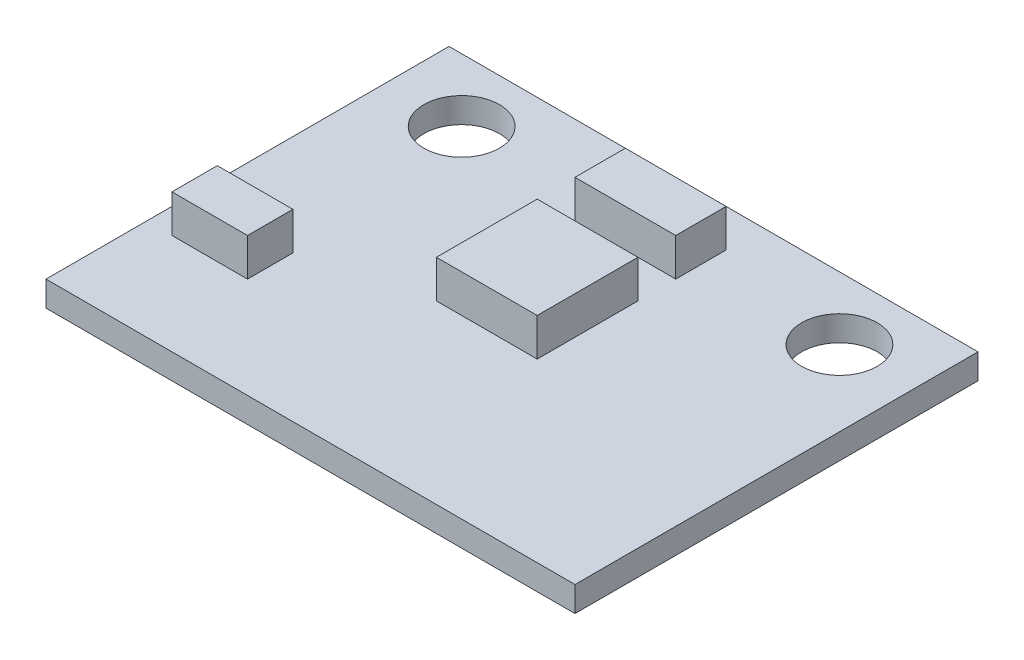
from build123d import *

# Parameters (mm, degrees)
SKETCH1_W        = 21
SKETCH1_H        = 16
SKETCH1_R        = 1.5
PCB_DEPTH        = 1
SKETCH2_W        = 4
SKETCH2_H        = 4
SKETCH2_W_2      = 3
SKETCH2_H_2      = 1.8
COMPONENTS_DEPTH = 1.5
SKETCH3_W        = 4
SKETCH3_H        = 2
CAPACITOR_DEPTH  = 1.5


with BuildPart() as part:
    # Sketch1 → PCB (new body)
    with BuildSketch(Plane(origin=(0, 0, 0), x_dir=(1, 0, 0), z_dir=(0, 1, 0))):
        Rectangle(SKETCH1_W, SKETCH1_H)
        with Locations((-7.5, 5.5)):
            Circle(SKETCH1_R, mode=Mode.SUBTRACT)
        with Locations((7.5, 5.5)):
            Circle(SKETCH1_R, mode=Mode.SUBTRACT)
    extrude(amount=PCB_DEPTH)

    # Sketch2 → Components (add)
    with BuildSketch(Plane(origin=(0, 1, 0), x_dir=(1, 0, 0), z_dir=(0, 1, 0))):
        with Locations((0, 1)):
            Rectangle(SKETCH2_W, SKETCH2_H)
        with Locations((-8, -3.1)):
            Rectangle(SKETCH2_W_2, SKETCH2_H_2)
    extrude(amount=COMPONENTS_DEPTH)

    # Sketch3 → Capacitor (add)
    with BuildSketch(Plane(origin=(0, 1, 0), x_dir=(1, 0, 0), z_dir=(0, 1, 0))):
        with Locations((0, 5.5)):
            Rectangle(SKETCH3_W, SKETCH3_H)
    extrude(amount=CAPACITOR_DEPTH)


solid = part.part
